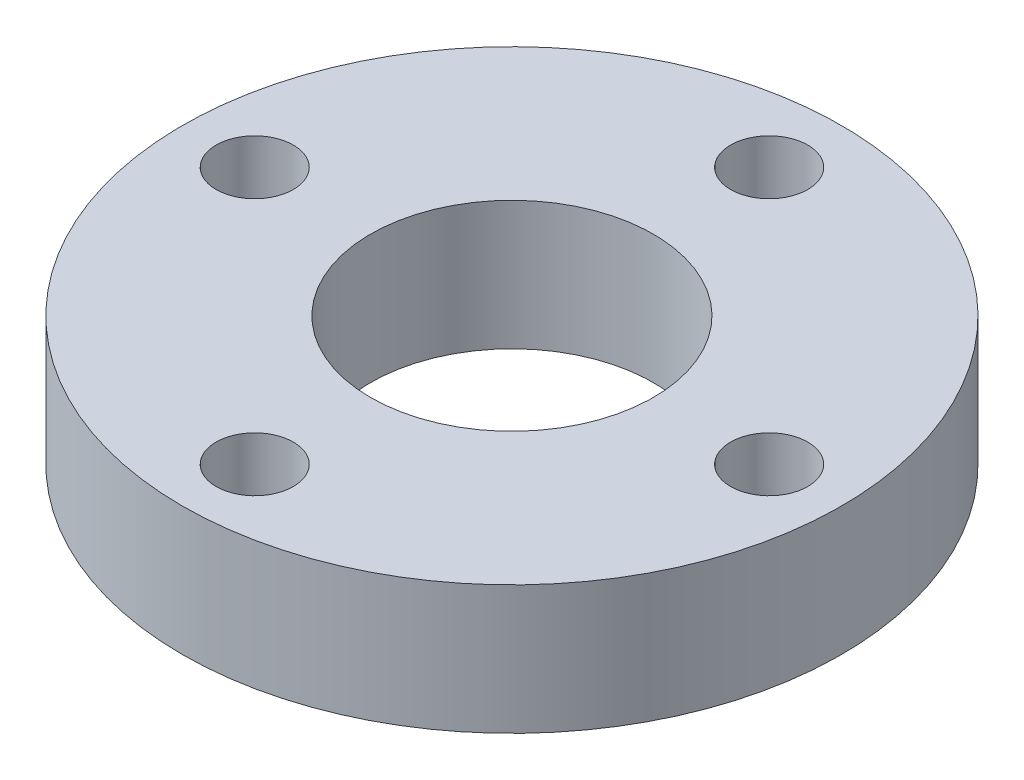
from build123d import *

# Parameters (mm, degrees)
SKETCH1_R           = 10.25
SKETCH1_R_2         = 1.2
SKETCH1_R_3         = 4.4
BOSS_EXTRUDE1_DEPTH = 4


with BuildPart() as part:
    # Sketch1 → Boss-Extrude1 (new body)
    with BuildSketch(Plane(origin=(0, 0, 0), x_dir=(1, 0, 0), z_dir=(0, 1, 0))):
        Circle(SKETCH1_R)
        with Locations((0, 8)):
            Circle(SKETCH1_R_2, mode=Mode.SUBTRACT)
        with Locations((-8, 0)):
            Circle(SKETCH1_R_2, mode=Mode.SUBTRACT)
        with Locations((0, -8)):
            Circle(SKETCH1_R_2, mode=Mode.SUBTRACT)
        with Locations((8, 0)):
            Circle(SKETCH1_R_2, mode=Mode.SUBTRACT)
        Circle(SKETCH1_R_3, mode=Mode.SUBTRACT)
    extrude(amount=BOSS_EXTRUDE1_DEPTH)


solid = part.part
